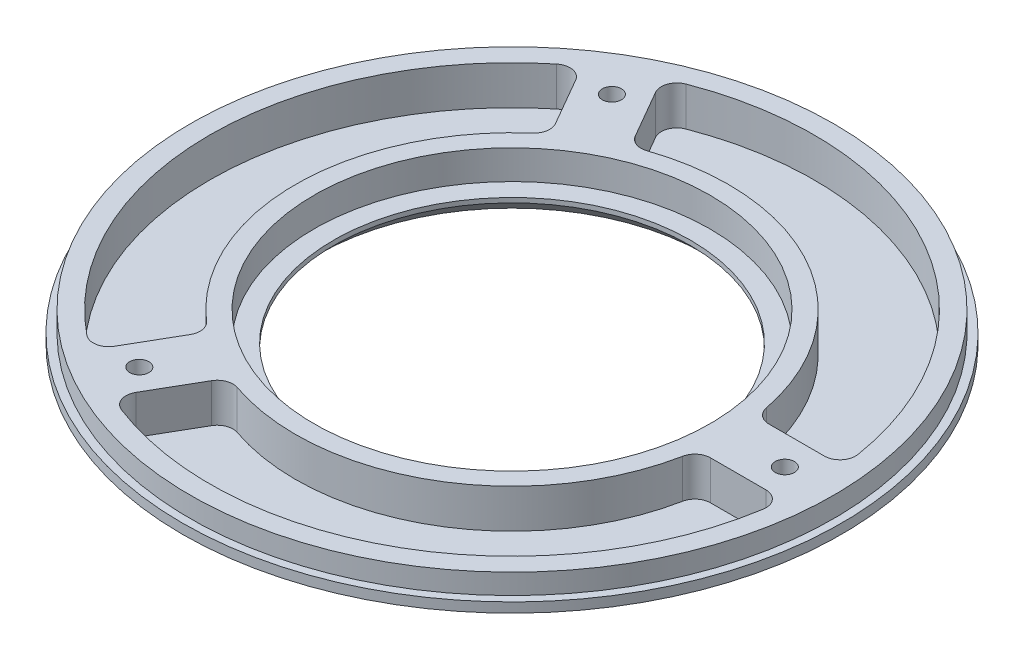
from build123d import *

# Parameters (mm, degrees)
F_90_0_0087_DIAMETER_HOLE1_D                        = 0.22098
CIRPATTERN3_COUNT                                   = 3
CUT_EXTRUDE1_DEPTH                                  = 10
FILLET1_R                                           = 4
CIRPATTERN4_COUNT                                   = 3
FILLET1_OF_CIRPATTERN4_R                            = 4
CHAMFER1_SIZE                                       = 4
BOSS_EXTRUDE1_START                                 = -7.5
SKETCH10_R                                          = 84.55
SKETCH10_R_2                                        = 82.55
BOSS_EXTRUDE1_DEPTH                                 = 7.5
CHAMFER3_SIZE                                       = 5
CHAMFER3_SIZE2                                      = 8.660254038
FILLET4_R                                           = 5
CBORE_FOR_10_BINDING_HEAD_MACHINE_SCREW_D           = 4.9149
CBORE_FOR_10_BINDING_HEAD_MACHINE_SCREW_CBORE_D     = 9.525
CBORE_FOR_10_BINDING_HEAD_MACHINE_SCREW_CBORE_DEPTH = 2.794
CIRPATTERN5_COUNT                                   = 3


with BuildPart() as part:
    # Sketch2 → Revolve1 (revolve)
    with BuildSketch(Plane(origin=(0, 0, 0), x_dir=(0, 0, -1), z_dir=(1, 0, 0))):
        Polygon((-45.8, 0), (-82.55, 0), (-82.55, 12.7), (-50.8, 12.7), (-50.8, 5.2), (-45.8, 5.2), align=None)
    revolve(axis=Axis((0, -0.900399161, 0), (0, 1, 0)))

    # #90 (0.0087) Diameter Hole1 (through all)
    with Locations(Plane(origin=(0, 12.7, 0), x_dir=(1, 0, 0), z_dir=(0, 1, 0))):
        with Locations((-35, 60.621778265)):
            f_90_0_0087_diameter_hole1 = Hole(F_90_0_0087_DIAMETER_HOLE1_D / 2)

    # CirPattern3: #90 (0.0087) Diameter Hole1 ×3 about axis
    cirpattern3_axis = Axis((0, -0.900399161, 0), (0, 1, 0))
    for i in range(1, CIRPATTERN3_COUNT):
        add(f_90_0_0087_diameter_hole1.rotate(cirpattern3_axis, i * 360 / CIRPATTERN3_COUNT), mode=Mode.SUBTRACT)

    # Sketch8 → Cut-Extrude1 (cut)
    with BuildSketch(Plane(origin=(0, 12.7, 0), x_dir=(1, 0, 0), z_dir=(0, 1, 0))):
        with BuildLine():
            Line((-21.025494874, 51.417225376), (-32.098048841, 70.595451416))
            ThreePointArc((-32.098048841, 70.595451416), (38.775, 67.160270063), (77.186478738, 7.5))
            Line((77.186478738, 7.5), (55.041370804, 7.5))
            ThreePointArc((55.041370804, 7.5), (27.775, 48.10771118), (-21.025494874, 51.417225376))
        make_face()
    cut_extrude1 = extrude(amount=-CUT_EXTRUDE1_DEPTH, mode=Mode.SUBTRACT)

    # Fillet1
    fillet1_edges = [part.edges().sort_by_distance(p)[0] for p in [
        (-21.025494874, 7.7, -51.417225376),
        (55.041370804, 7.7, -7.5),
        (77.186478738, 7.7, -7.5),
        (-32.098048841, 7.7, -70.595451416),
    ]]
    fillet(fillet1_edges, radius=FILLET1_R)

    # CirPattern4: Cut-Extrude1 ×3 about axis
    cirpattern4_axis = Axis((0, -0.900399161, 0), (0, 1, 0))
    for i in range(1, CIRPATTERN4_COUNT):
        add(cut_extrude1.rotate(cirpattern4_axis, i * 360 / CIRPATTERN4_COUNT), mode=Mode.SUBTRACT)

    # Fillet1 of CirPattern4
    fillet1_of_cirpattern4_edges = [part.edges().sort_by_distance(p)[0] for p in [
        (-34.01587593, 7.7, 43.917225376),
        (-34.01587593, 7.7, -43.917225376),
        (-45.088429897, 7.7, -63.095451416),
        (-45.088429897, 7.7, 63.095451416),
        (55.041370804, 7.7, 7.5),
        (-21.025494874, 7.7, 51.417225376),
        (-32.098048841, 7.7, 70.595451416),
        (77.186478738, 7.7, 7.5),
    ]]
    fillet(fillet1_of_cirpattern4_edges, radius=FILLET1_OF_CIRPATTERN4_R)

    # Chamfer1
    chamfer1_edges = [part.edges().sort_by_distance(p)[0] for p in [
        (0, 0, -45.8),
    ]]
    chamfer(chamfer1_edges, length=CHAMFER1_SIZE)

    # Sketch10 → Boss-Extrude1 (add)
    with BuildSketch(Plane.XZ.offset(BOSS_EXTRUDE1_START)):
        Circle(SKETCH10_R)
        Circle(SKETCH10_R_2, mode=Mode.SUBTRACT)
    extrude(amount=BOSS_EXTRUDE1_DEPTH)

    # Chamfer3
    chamfer3_edges = [part.edges().sort_by_distance(p)[0] for p in [
        (-84.55, 0, 0),
    ]]
    chamfer3_side = [part.faces().sort_by_distance(p)[0] for p in [
        (-84.55, 3.75, 0),
    ]]
    chamfer(chamfer3_edges, length=CHAMFER3_SIZE, length2=CHAMFER3_SIZE2, reference=chamfer3_side[0])

    # Fillet4
    fillet4_edges = [part.edges().sort_by_distance(p)[0] for p in [
        (-75.889745962, 0, 0),
    ]]
    fillet(fillet4_edges, radius=FILLET4_R)

    # CBORE for #10 Binding Head Machine Screw1 (through all)
    with Locations(Plane(origin=(0, 0, 0), x_dir=(-1, 0, 0), z_dir=(0, -1, 0))):
        with Locations((35, 60.621778265)):
            cbore_for_10_binding_head_machine_screw = CounterBoreHole(CBORE_FOR_10_BINDING_HEAD_MACHINE_SCREW_D / 2, CBORE_FOR_10_BINDING_HEAD_MACHINE_SCREW_CBORE_D / 2, CBORE_FOR_10_BINDING_HEAD_MACHINE_SCREW_CBORE_DEPTH)

    # CirPattern5: CBORE for #10 Binding Head Machine Screw1 ×3 about axis
    cirpattern5_axis = Axis((0, -0.900399161, 0), (0, 1, 0))
    for i in range(1, CIRPATTERN5_COUNT):
        add(cbore_for_10_binding_head_machine_screw.rotate(cirpattern5_axis, i * 360 / CIRPATTERN5_COUNT), mode=Mode.SUBTRACT)


solid = part.part
